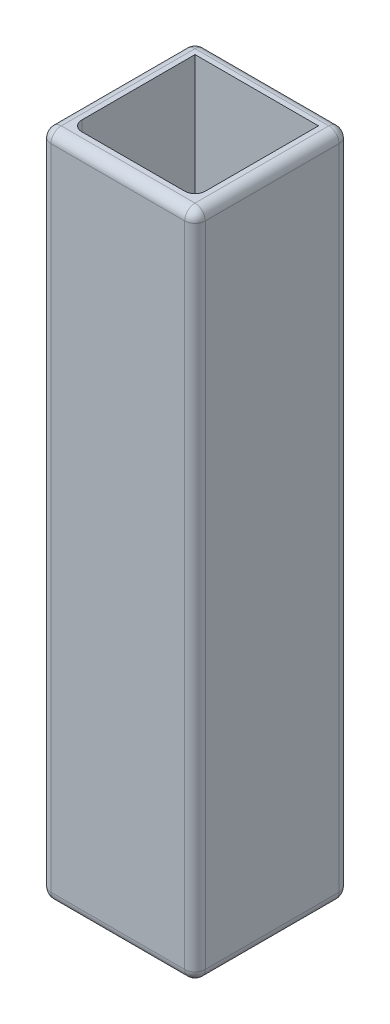
from build123d import *

# Parameters (mm, degrees)
CROQUIS1_W              = 30
CROQUIS1_H              = 30
CROQUIS1_W_2            = 24
CROQUIS1_H_2            = 24
SALIENTE_EXTRUIR1_DEPTH = 130
REDONDEO2_R             = 2


with BuildPart() as part:
    # Croquis1 → Saliente-Extruir1 (new body)
    with BuildSketch(Plane(origin=(0, 0, 0), x_dir=(1, 0, 0), z_dir=(0, 1, 0))):
        Rectangle(CROQUIS1_W, CROQUIS1_H)
        Rectangle(CROQUIS1_W_2, CROQUIS1_H_2, mode=Mode.SUBTRACT)
    extrude(amount=SALIENTE_EXTRUIR1_DEPTH)

    # Redondeo2
    redondeo2_edges = [part.edges().sort_by_distance(p)[0] for p in [
        (-12, 65, 12),
        (12, 65, 12),
        (-15, 65, -15),
        (-15, 65, 15),
        (15, 65, -15),
        (15, 65, 15),
        (-15, 130, 0),
        (0, 130, 15),
        (15, 130, 0),
        (0, 130, -15),
        (0, 0, 15),
        (15, 0, 0),
        (-15, 0, 0),
        (0, 0, -15),
    ]]
    fillet(redondeo2_edges, radius=REDONDEO2_R)


solid = part.part
